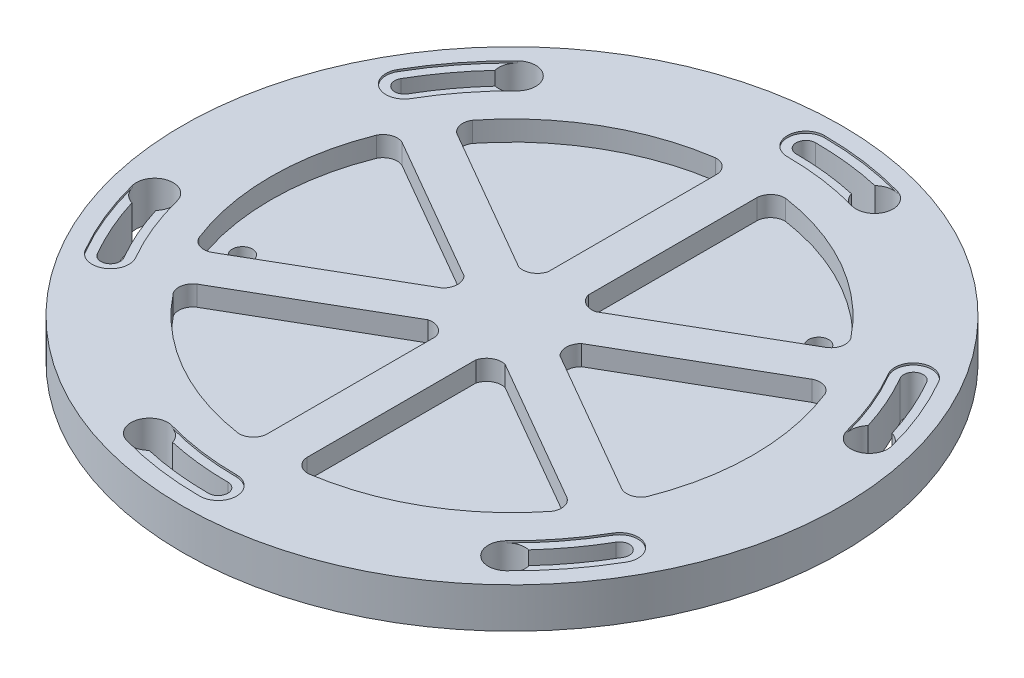
from build123d import *

# Parameters (mm, degrees)
SKETCH1_R           = 82
BOSS_EXTRUDE1_DEPTH = 10
BOSS_EXTRUDE3_DEPTH = 9.525
CIRPATTERN1_COUNT   = 6
CUT_EXTRUDE1_DEPTH  = 5
SKETCH3_R           = 2.5
CUT_EXTRUDE2_DEPTH  = 5
SKETCH3_3_R         = 2.5
CUT_EXTRUDE3_DEPTH  = 5


with BuildPart() as part:
    # Sketch1 → Boss-Extrude1 (new body)
    with BuildSketch(Plane(origin=(0, 0, 0), x_dir=(1, 0, 0), z_dir=(0, 1, 0))):
        Circle(SKETCH1_R)
        with BuildLine():
            ThreePointArc((0, -68.539794907), (4.585205093, -73.125), (0, -77.710205093))
            ThreePointArc((0, -77.710205093), (-10.627709007, -76.980047914), (-21.05570427, -74.803297343))
            ThreePointArc((-21.05570427, -74.803297343), (-24.227021824, -69.147242492), (-18.570966974, -65.975924939))
            ThreePointArc((-18.570966974, -65.975924939), (-9.373556469, -67.895801969), (0, -68.539794907))
        make_face(mode=Mode.SUBTRACT)
        with BuildLine():
            ThreePointArc((-59.357203559, -34.269897453), (-61.035505105, -40.533404092), (-67.299011744, -38.855102547))
            ThreePointArc((-67.299011744, -38.855102547), (-71.980531582, -29.286157973), (-75.309407921, -19.166873879))
            ThreePointArc((-75.309407921, -19.166873879), (-71.996779512, -13.592404889), (-66.422310522, -16.905033297))
            ThreePointArc((-66.422310522, -16.905033297), (-63.48626755, -25.830162958), (-59.357203559, -34.269897453))
        make_face(mode=Mode.SUBTRACT)
        with BuildLine():
            ThreePointArc((59.357203559, -34.269897453), (65.620710198, -32.591595908), (67.299011744, -38.855102547))
            ThreePointArc((67.299011744, -38.855102547), (61.352822575, -47.693889942), (54.25370365, -55.636423464))
            ThreePointArc((54.25370365, -55.636423464), (47.769757688, -55.554837604), (47.851343548, -49.070891641))
            ThreePointArc((47.851343548, -49.070891641), (54.112711081, -42.065639011), (59.357203559, -34.269897453))
        make_face(mode=Mode.SUBTRACT)
        with BuildLine():
            ThreePointArc((-59.357203559, 34.269897453), (-65.620710198, 32.591595908), (-67.299011744, 38.855102547))
            ThreePointArc((-67.299011744, 38.855102547), (-61.352822575, 47.693889942), (-54.25370365, 55.636423464))
            ThreePointArc((-54.25370365, 55.636423464), (-47.769757688, 55.554837604), (-47.851343548, 49.070891641))
            ThreePointArc((-47.851343548, 49.070891641), (-54.112711081, 42.065639011), (-59.357203559, 34.269897453))
        make_face(mode=Mode.SUBTRACT)
        with BuildLine():
            ThreePointArc((59.357203559, 34.269897453), (61.035505105, 40.533404092), (67.299011744, 38.855102547))
            ThreePointArc((67.299011744, 38.855102547), (71.980531582, 29.286157973), (75.309407921, 19.166873879))
            ThreePointArc((75.309407921, 19.166873879), (71.996779512, 13.592404889), (66.422310522, 16.905033297))
            ThreePointArc((66.422310522, 16.905033297), (63.48626755, 25.830162958), (59.357203559, 34.269897453))
        make_face(mode=Mode.SUBTRACT)
        with BuildLine():
            ThreePointArc((0, 68.539794907), (-4.585205093, 73.125), (0, 77.710205093))
            ThreePointArc((0, 77.710205093), (10.627709007, 76.980047914), (21.05570427, 74.803297343))
            ThreePointArc((21.05570427, 74.803297343), (24.227021824, 69.147242492), (18.570966974, 65.975924939))
            ThreePointArc((18.570966974, 65.975924939), (9.373556469, 67.895801969), (0, 68.539794907))
        make_face(mode=Mode.SUBTRACT)
    extrude(amount=BOSS_EXTRUDE1_DEPTH)

    # Sketch1<4> → Boss-Extrude3 (add)
    with BuildSketch(Plane(origin=(0, 0, 0), x_dir=(1, 0, 0), z_dir=(0, 1, 0))):
        with BuildLine():
            ThreePointArc((-75.309407921, -19.166873879), (-71.980531582, -29.286157973), (-67.299011744, -38.855102547))
            ThreePointArc((-67.299011744, -38.855102547), (-61.035505105, -40.533404092), (-59.357203559, -34.269897453))
            ThreePointArc((-59.357203559, -34.269897453), (-63.48626755, -25.830162958), (-66.422310522, -16.905033297))
            ThreePointArc((-66.422310522, -16.905033297), (-66.418285743, -19.150940539), (-67.48132535, -21.129339471))
            ThreePointArc((-67.48132535, -21.129339471), (-64.751733563, -28.414631056), (-61.238335159, -35.355969289))
            ThreePointArc((-61.238335159, -35.355969289), (-62.121576941, -38.652272492), (-65.417880144, -37.769030711))
            ThreePointArc((-65.417880144, -37.769030711), (-69.197773577, -30.293016611), (-72.126599919, -22.444427093))
            ThreePointArc((-72.126599919, -22.444427093), (-74.155284422, -21.230290389), (-75.309407921, -19.166873879))
        make_face()
    boss_extrude3 = extrude(amount=BOSS_EXTRUDE3_DEPTH)

    # CirPattern1: Boss-Extrude3 ×6 about axis
    cirpattern1_axis = Axis((0, 10, 0), (0, 1, 0))
    for i in range(1, CIRPATTERN1_COUNT):
        add(boss_extrude3.rotate(cirpattern1_axis, i * 360 / CIRPATTERN1_COUNT))

    # Sketch2 → Cut-Extrude1 (cut)
    with BuildSketch(Plane(origin=(0, 10, 0), x_dir=(1, 0, 0), z_dir=(0, 1, 0))):
        with BuildLine():
            Line((-14.620190528, 2.667468245), (-51.015872171, 23.680524839))
            ThreePointArc((-51.015872171, 23.680524839), (-53.723615936, 23.879831653), (-55.779211114, 22.106098875))
            ThreePointArc((-55.779211114, 22.106098875), (-60, 0), (-55.779211114, -22.106098875))
            ThreePointArc((-55.779211114, -22.106098875), (-53.723615936, -23.879831653), (-51.015872171, -23.680524839))
            Line((-51.015872171, -23.680524839), (-14.620190528, -2.667468245))
            ThreePointArc((-14.620190528, -2.667468245), (-13.515289004, 0), (-14.620190528, 2.667468245))
        make_face()
        with BuildLine():
            Line((-5, 13.995190528), (-5, 56.021303716))
            ThreePointArc((-5, 56.021303716), (-6.181267118, 58.46593201), (-8.745162353, 59.359263266))
            ThreePointArc((-8.745162353, 59.359263266), (-30, 51.961524227), (-47.034048761, 37.253164391))
            ThreePointArc((-47.034048761, 37.253164391), (-47.542348818, 34.586100357), (-46.015872171, 32.340778877))
            Line((-46.015872171, 32.340778877), (-9.620190528, 11.327722283))
            ThreePointArc((-9.620190528, 11.327722283), (-6.757644502, 11.704583617), (-5, 13.995190528))
        make_face()
        with BuildLine():
            Line((-9.620190528, -11.327722283), (-46.015872171, -32.340778877))
            ThreePointArc((-46.015872171, -32.340778877), (-47.542348818, -34.586100357), (-47.034048761, -37.253164391))
            ThreePointArc((-47.034048761, -37.253164391), (-30, -51.961524227), (-8.745162353, -59.359263266))
            ThreePointArc((-8.745162353, -59.359263266), (-6.181267118, -58.46593201), (-5, -56.021303716))
            Line((-5, -56.021303716), (-5, -13.995190528))
            ThreePointArc((-5, -13.995190528), (-6.757644502, -11.704583617), (-9.620190528, -11.327722283))
        make_face()
        with BuildLine():
            Line((9.620190528, 11.327722283), (46.015872171, 32.340778877))
            ThreePointArc((46.015872171, 32.340778877), (47.542348818, 34.586100357), (47.034048761, 37.253164391))
            ThreePointArc((47.034048761, 37.253164391), (30, 51.961524227), (8.745162353, 59.359263266))
            ThreePointArc((8.745162353, 59.359263266), (6.181267118, 58.46593201), (5, 56.021303716))
            Line((5, 56.021303716), (5, 13.995190528))
            ThreePointArc((5, 13.995190528), (6.757644502, 11.704583617), (9.620190528, 11.327722283))
        make_face()
        with BuildLine():
            Line((14.620190528, -2.667468245), (51.015872171, -23.680524839))
            ThreePointArc((51.015872171, -23.680524839), (53.723615936, -23.879831653), (55.779211114, -22.106098875))
            ThreePointArc((55.779211114, -22.106098875), (60, 0), (55.779211114, 22.106098875))
            ThreePointArc((55.779211114, 22.106098875), (53.723615936, 23.879831653), (51.015872171, 23.680524839))
            Line((51.015872171, 23.680524839), (14.620190528, 2.667468245))
            ThreePointArc((14.620190528, 2.667468245), (13.515289004, 0), (14.620190528, -2.667468245))
        make_face()
        with BuildLine():
            Line((5, -13.995190528), (5, -56.021303716))
            ThreePointArc((5, -56.021303716), (6.181267118, -58.46593201), (8.745162353, -59.359263266))
            ThreePointArc((8.745162353, -59.359263266), (30, -51.961524227), (47.034048761, -37.253164391))
            ThreePointArc((47.034048761, -37.253164391), (47.542348818, -34.586100357), (46.015872171, -32.340778877))
            Line((46.015872171, -32.340778877), (9.620190528, -11.327722283))
            ThreePointArc((9.620190528, -11.327722283), (6.757644502, -11.704583617), (5, -13.995190528))
        make_face()
    extrude(amount=-CUT_EXTRUDE1_DEPTH, mode=Mode.SUBTRACT)

    # Sketch3 → Cut-Extrude2 (cut)
    with BuildSketch(Plane.XZ):
        with Locations((-51.685176347, 15.403969857)):
            Circle(SKETCH3_R)
    extrude(amount=-CUT_EXTRUDE2_DEPTH, mode=Mode.SUBTRACT)

    # Sketch3<3> → Cut-Extrude3 (cut)
    with BuildSketch(Plane.XZ):
        with Locations((39.514507533, -36.782411469)):
            Circle(SKETCH3_3_R)
    extrude(amount=-CUT_EXTRUDE3_DEPTH, mode=Mode.SUBTRACT)


solid = part.part
